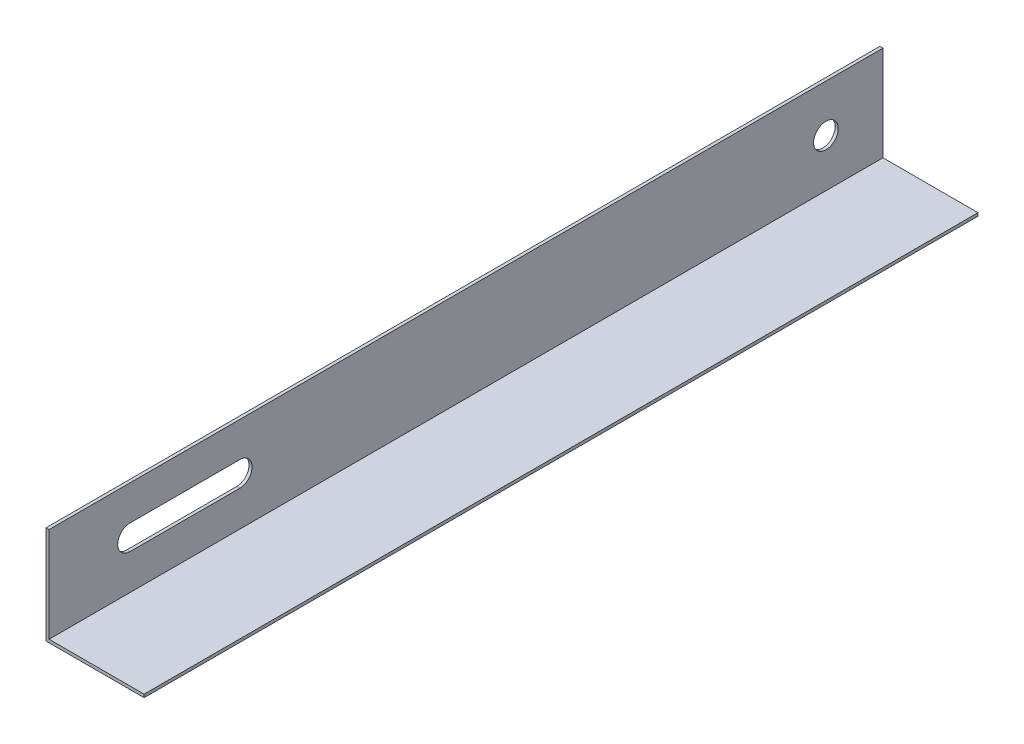
from build123d import *

# Parameters (mm, degrees)
BOSS_EXTRUDE2_DEPTH = 431.8
CUT_EXTRUDE3_DEPTH  = 127
SKETCH7_R           = 6.3881
CUT_EXTRUDE4_DEPTH  = 127


with BuildPart() as part:
    # Sketch3 → Boss-Extrude2 (new body)
    with BuildSketch(Plane.XY):
        Polygon((0, 0), (0, 49.2125), (-1.5875, 49.2125), (-1.5875, -1.5875), (49.2125, -1.5875), (49.2125, 0), align=None)
    extrude(amount=BOSS_EXTRUDE2_DEPTH)

    # Sketch6 → Cut-Extrude3 (cut)
    with BuildSketch(Plane(origin=(0, 0, 0), x_dir=(0, 0, -1), z_dir=(1, 0, 0))):
        with BuildLine():
            Line((-389.847492111, 31.187094829), (-333.093769426, 31.187094829))
            ThreePointArc((-333.093769426, 31.187094829), (-326.680269426, 24.773594829), (-333.093769426, 18.360094829))
            Line((-333.093769426, 18.360094829), (-389.847492111, 18.360094829))
            ThreePointArc((-389.847492111, 18.360094829), (-396.260992111, 24.773594829), (-389.847492111, 31.187094829))
        make_face()
    extrude(amount=-CUT_EXTRUDE3_DEPTH, mode=Mode.SUBTRACT)

    # Sketch7 → Cut-Extrude4 (cut)
    with BuildSketch(Plane(origin=(0, 0, 0), x_dir=(0, 0, -1), z_dir=(1, 0, 0))):
        with Locations((-29.538792285, 24.773594829)):
            Circle(SKETCH7_R)
    extrude(amount=-CUT_EXTRUDE4_DEPTH, mode=Mode.SUBTRACT)


solid = part.part
